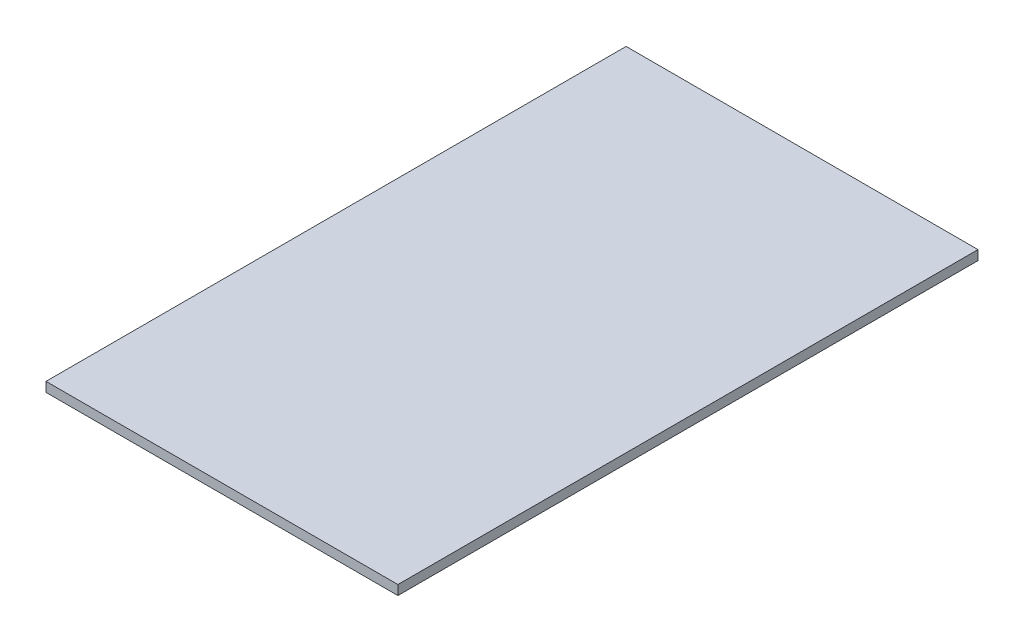
from build123d import *

# Parameters (mm, degrees)
SKETCH1_W           = 116.68
SKETCH1_H           = 192.3454
BOSS_EXTRUDE1_DEPTH = 3.175


with BuildPart() as part:
    # Sketch1 → Boss-Extrude1 (new body)
    with BuildSketch(Plane(origin=(0, 0, 0), x_dir=(1, 0, 0), z_dir=(0, 1, 0))):
        Rectangle(SKETCH1_W, SKETCH1_H)
    extrude(amount=BOSS_EXTRUDE1_DEPTH)


solid = part.part
